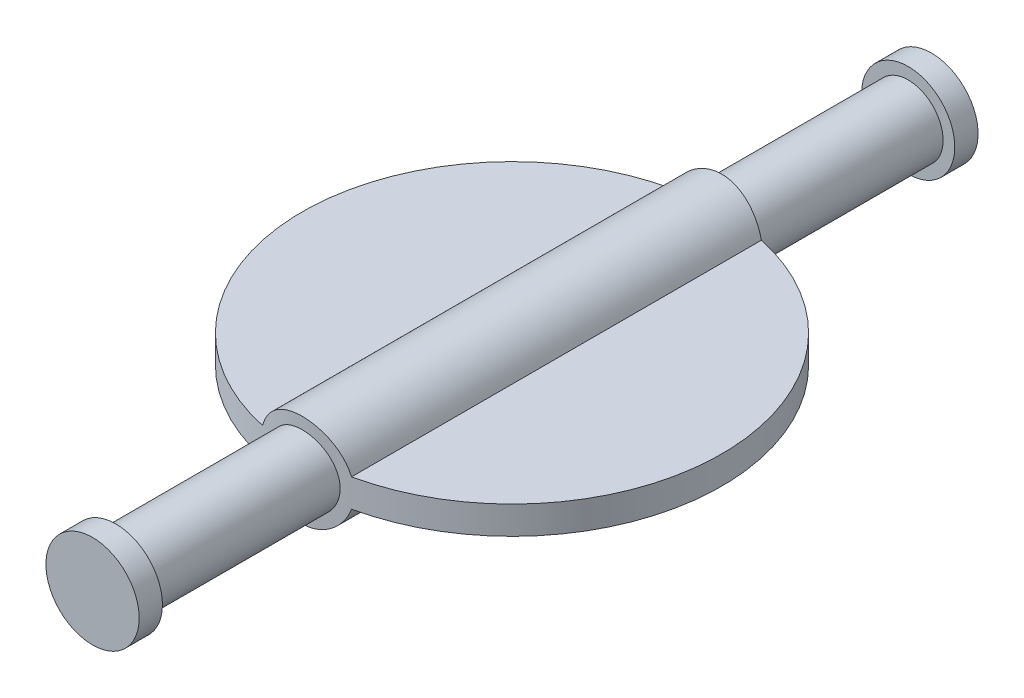
from build123d import *

# Parameters (mm, degrees)
SKETCH1_R                            = 1.5
BOSS_EXTRUDE1_DEPTH                  = 36
SKETCH2_R                            = 2
BOSS_EXTRUDE2_DEPTH                  = 1
BOSS_EXTRUDE4_START                  = -1
SKETCH3_R                            = 2
BOSS_EXTRUDE4_DEPTH                  = 1
BOSS_EXTRUDE6_DEPTH                  = 0.6
BOSS_EXTRUDE6_DEPTH_BACK             = 0.6
SKETCH8_R                            = 9
BOSS_EXTRUDE5_REACH                  = 22.224
BOSS_EXTRUDE5_END_RADIUS             = 9
SKETCH4_R                            = 2
BOSS_EXTRUDE5_DIRECTION_2_REACH      = 22.224
BOSS_EXTRUDE5_DIRECTION_2_END_RADIUS = 9


with BuildPart() as part:
    # Sketch1 → Boss-Extrude1 (new body)
    with BuildSketch(Plane.XY):
        Circle(SKETCH1_R)
    extrude(amount=BOSS_EXTRUDE1_DEPTH)

    # Sketch2 → Boss-Extrude2 (add)
    with BuildSketch(Plane(origin=(0, 0, 0), x_dir=(-1, 0, 0), z_dir=(0, 0, -1))):
        Circle(SKETCH2_R)
    extrude(amount=-BOSS_EXTRUDE2_DEPTH)

    # Sketch3 → Boss-Extrude4 (add)
    with BuildSketch(Plane.XY.offset(36).offset(BOSS_EXTRUDE4_START)):
        Circle(SKETCH3_R)
    extrude(amount=BOSS_EXTRUDE4_DEPTH)

    # Sketch8 → Boss-Extrude6 (add, two sides: drawn at the far end of the back side and taken through both)
    with BuildSketch(Plane(origin=(0, 0, 0), x_dir=(-1, 0, 0), z_dir=(0, -1, 0)).offset(-BOSS_EXTRUDE6_DEPTH_BACK)):
        with Locations((0, -18)):
            Circle(SKETCH8_R)
    extrude(amount=BOSS_EXTRUDE6_DEPTH + BOSS_EXTRUDE6_DEPTH_BACK)

    # Boss-Extrude5: up to this cylinder (the profile starts inside it)
    boss_extrude5_end = Plane(origin=(0, 0, 18), z_dir=(0, -1, 0)) * Cylinder(BOSS_EXTRUDE5_END_RADIUS, 63.448, mode=Mode.PRIVATE)
    # Sketch4 → Boss-Extrude5 (add, up to the surface)
    with BuildSketch(Plane.XY.offset(18), mode=Mode.PRIVATE) as boss_extrude5_sk1:
        Circle(SKETCH4_R)
    boss_extrude5_tool1 = extrude(boss_extrude5_sk1.sketch, amount=BOSS_EXTRUDE5_REACH, mode=Mode.PRIVATE) & boss_extrude5_end
    add(boss_extrude5_tool1.solids().sort_by_distance((0, 0, 18))[0])

    # Boss-Extrude5 direction 2: up to this cylinder (the profile starts inside it)
    boss_extrude5_direction_2_end = Plane(origin=(0, 0, 18), z_dir=(0, -1, 0)) * Cylinder(BOSS_EXTRUDE5_DIRECTION_2_END_RADIUS, 63.448, mode=Mode.PRIVATE)
    # Sketch4 → Boss-Extrude5 direction 2 (add, up to the surface)
    with BuildSketch(Plane.XY.offset(18), mode=Mode.PRIVATE) as boss_extrude5_direction_2_sk1:
        Circle(SKETCH4_R)
    boss_extrude5_direction_2_tool1 = extrude(boss_extrude5_direction_2_sk1.sketch, amount=-BOSS_EXTRUDE5_DIRECTION_2_REACH, mode=Mode.PRIVATE) & boss_extrude5_direction_2_end
    add(boss_extrude5_direction_2_tool1.solids().sort_by_distance((0, 0, 18))[0])


solid = part.part
